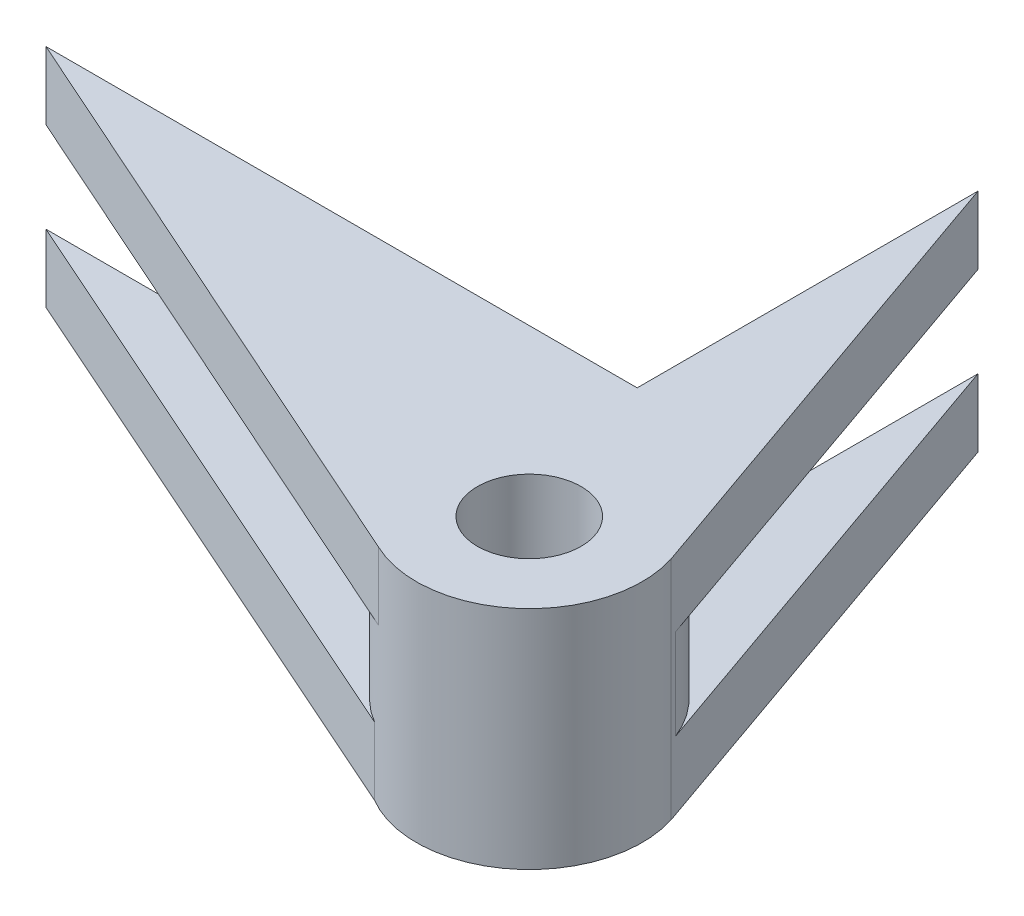
from build123d import *

# Parameters (mm, degrees)
BOSS_EXTRUDE1_DEPTH = 6
SKETCH1_3_R         = 4.590078396
BOSS_EXTRUDE2_DEPTH = 20
BOSS_EXTRUDE3_START = -6
BOSS_EXTRUDE3_DEPTH = 6


with BuildPart() as part:
    # Sketch1 → Boss-Extrude1 (new body)
    with BuildSketch(Plane(origin=(0, 0, 0), x_dir=(1, 0, 0), z_dir=(0, 1, 0))):
        with BuildLine():
            Line((45.01233756, -11.03843864), (30.598786144, 30.167258341))
            Line((30.598786144, 30.167258341), (30.598786144, 0))
            Line((30.598786144, 0), (0, 0))
            Line((0, 0), (-21.72538797, 0))
            Line((-21.72538797, 0), (30.598786144, -23.243306965))
            ThreePointArc((30.598786144, -23.243306965), (29.21752634, -6.998682971), (45.01233756, -11.03843864))
        make_face()
    extrude(amount=BOSS_EXTRUDE1_DEPTH)

    # Sketch1<3> → Boss-Extrude2 (add)
    with BuildSketch(Plane(origin=(0, 0, 0), x_dir=(1, 0, 0), z_dir=(0, 1, 0))):
        with BuildLine():
            Line((45.216343262, -11.621653482), (45.01233756, -11.03843864))
            ThreePointArc((45.01233756, -11.03843864), (29.21752634, -6.998682971), (30.598786144, -23.243306965))
            ThreePointArc((30.598786144, -23.243306965), (40.639057931, -23.31382012), (45.679659415, -14.630251363))
            ThreePointArc((45.679659415, -14.630251363), (45.563151674, -13.108219574), (45.216343262, -11.621653482))
        make_face()
        with Locations((35.679659415, -14.630251363)):
            Circle(SKETCH1_3_R, mode=Mode.SUBTRACT)
    extrude(amount=BOSS_EXTRUDE2_DEPTH)

    # Sketch2 → Boss-Extrude3 (add)
    with BuildSketch(Plane(origin=(0, 20, 0), x_dir=(1, 0, 0), z_dir=(0, 1, 0)).offset(BOSS_EXTRUDE3_START)):
        with BuildLine():
            ThreePointArc((31.366142543, -23.652089989), (28.891872953, -7.286821991), (45.01233756, -11.03843864))
            Line((45.01233756, -11.03843864), (30.598786144, 30.167258341))
            Line((30.598786144, 30.167258341), (30.598786144, 0))
            Line((30.598786144, 0), (-21.72538797, 0))
            Line((-21.72538797, 0), (31.366142543, -23.652089989))
        make_face()
    extrude(amount=BOSS_EXTRUDE3_DEPTH)


solid = part.part
